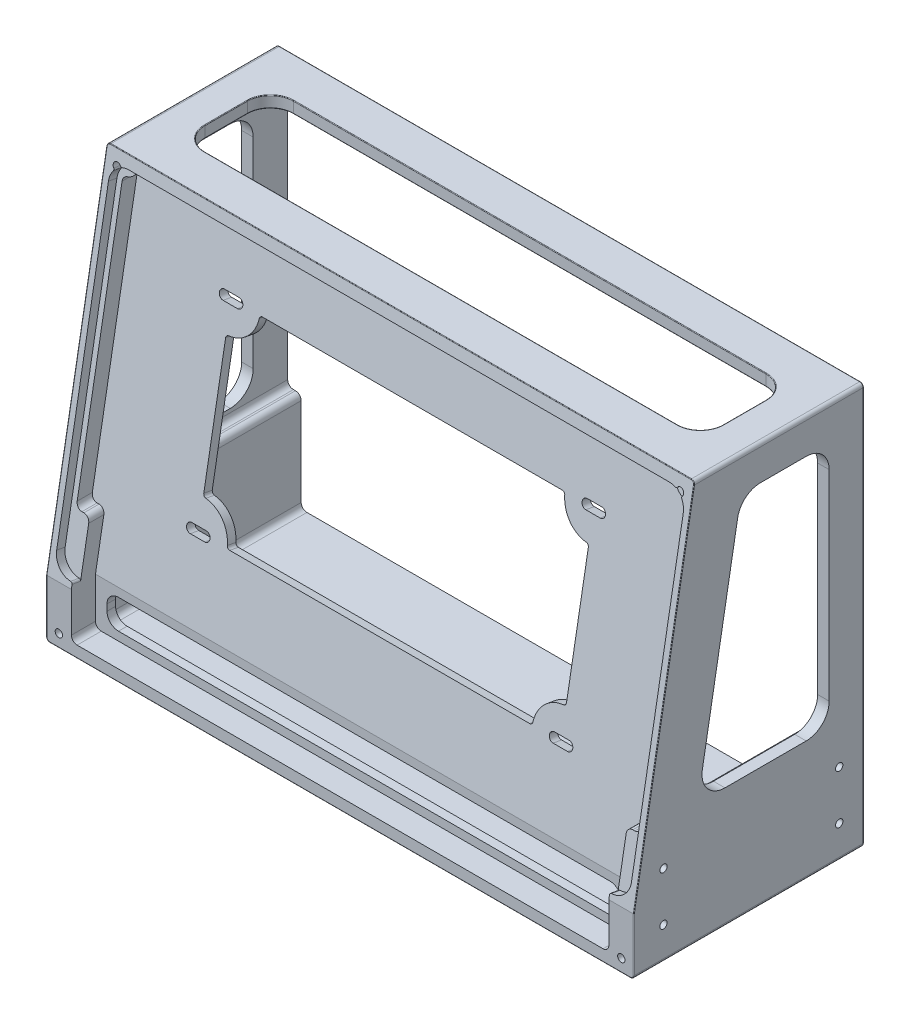
from build123d import *

# Parameters (mm, degrees)
EXTRUDE_1_DEPTH                   = 80
FILLET_1_R                        = 1.2
SKETCH_11_R                       = 4.351471862576191
EXTRUDE_6_DEPTH                   = 80
CUT_EXTRUDE_1_DEPTH               = 231.44795507879866
EXTRUDE_3_DEPTH                   = 3
HOLE_WIZARD_M31_D                 = 3.15
HOLE_WIZARD_M31_DEPTH             = 8.5
HOLE_WIZARD_M31_TIP               = 0.9463554749684074
HOLE_WIZARD_M31_ON_FACE_2_D       = 3.15
HOLE_WIZARD_M31_ON_FACE_2_DEPTH   = 8.5
HOLE_WIZARD_M31_ON_FACE_2_TIP     = 0.9463554749684074
HOLE_WIZARD_M31_ON_FACE_3_D       = 3.15
HOLE_WIZARD_M31_ON_FACE_3_DEPTH   = 8.5
HOLE_WIZARD_M31_ON_FACE_3_TIP     = 0.9463554749684074
HOLE_WIZARD_M2_51_D               = 2.55
HOLE_WIZARD_M2_51_DEPTH           = 20
HOLE_WIZARD_M2_51_TIP             = 0.7660972892601393
FILLET_2_R                        = 1
HOLE_WIZARD_M2_52_D               = 2.55
HOLE_WIZARD_M2_52_DEPTH           = 8.5
HOLE_WIZARD_M2_52_TIP             = 0.7660972892601393
HOLE_WIZARD_M2_52_ON_FACE_2_D     = 2.55
HOLE_WIZARD_M2_52_ON_FACE_2_DEPTH = 8.5
HOLE_WIZARD_M2_52_ON_FACE_2_TIP   = 0.7660972892601393
HOLE_WIZARD_M2_52_ON_FACE_3_D     = 2.55
HOLE_WIZARD_M2_52_ON_FACE_3_DEPTH = 8.5
HOLE_WIZARD_M2_52_ON_FACE_3_TIP   = 0.7660972892601393
EXTRUDE_7_REACH                   = 149.449
FILLET_3_R                        = 2
HOLE_WIZARD_M30_D                 = 2.55
HOLE_WIZARD_M30_DEPTH             = 7
HOLE_WIZARD_M30_TIP               = 0.7660972892601393
HOLE_WIZARD_M30_ON_FACE_2_D       = 2.55
HOLE_WIZARD_M30_ON_FACE_2_DEPTH   = 7
HOLE_WIZARD_M30_ON_FACE_2_TIP     = 0.7660972892601393
CUT_EXTRUDE_2_DEPTH               = 227.90583965618865
EXTRUDE_8_DEPTH                   = 3
CUT_EXTRUDE_3_DEPTH               = 4
HOLE_WIZARD_M31_2_D               = 3.4
HOLE_WIZARD_M31_2_DEPTH           = 8.5
HOLE_WIZARD_M31_2_CBORE_D         = 6.5
HOLE_WIZARD_M31_2_CBORE_DEPTH     = 3
HOLE_WIZARD_M31_2_TIP             = 1.0214630523468524
SKETCH_22_W                       = 180.5
SKETCH_22_H                       = 30.840762314985035
CUT_EXTRUDE_4_DEPTH               = 4
CUT_EXTRUDE_5_DEPTH               = 231.44795523258608
FILLET_26_R                       = 8
FILLET_27_R                       = 0.2
CUT_EXTRUDE_8_DEPTH               = 3
FILLET_32_R                       = 4
CUT_EXTRUDE_START                 = -73.991163
CUT_EXTRUDE_9_DEPTH               = 82.191163
FILLET_33_R                       = 0.6


with BuildPart() as part:
    # Эскиз2 → Вытянуть-Тонкостенный1 (new body)
    with BuildSketch(Plane.XY):
        Polygon((-102.25000000000003, 69.89999999999998), (102.24999999999997, 69.9), (102.24999999999997, -69.9), (-102.25000000000003, -69.90000000000003), align=None)
        Polygon((-98.25000000000003, 65.89999999999998), (98.24999999999997, 65.9), (98.24999999999997, -65.9), (-98.25000000000003, -65.90000000000003), align=None, mode=Mode.SUBTRACT)
    extrude(amount=EXTRUDE_1_DEPTH)

    # Скругление1
    fillet_1_edges = [part.edges().sort_by_distance(p)[0] for p in [
        (-98.25000000000003, 65.89999999999998, 40),
        (-98.25000000000003, -65.90000000000003, 40),
        (98.24999999999997, -65.9, 40),
        (98.24999999999997, 65.9, 40),
        (-102.25000000000003, 69.89999999999998, 40),
        (102.24999999999997, 69.9, 40),
        (102.24999999999997, -69.9, 40),
        (-102.25000000000003, -69.90000000000003, 40),
    ]]
    fillet(fillet_1_edges, radius=FILLET_1_R)

    # Эскиз11 → Бобышка-Вытянуть6 (add)
    with BuildSketch(Plane.XY.offset(80)):
        with Locations((-97.89852813742387, 65.54852813742384)):
            Circle(SKETCH_11_R)
        with Locations((97.89852813742382, 65.54852813742386)):
            Circle(SKETCH_11_R)
        with Locations((97.89852813742382, -65.54852813742386)):
            Circle(SKETCH_11_R)
        with Locations((-97.89852813742388, -65.54852813742389)):
            Circle(SKETCH_11_R)
    extrude(amount=-EXTRUDE_6_DEPTH)

    # Эскиз3 → Вырез-Вытянуть1 (cut, through all)
    with BuildSketch(Plane.ZY.offset(102.25000000000003)):
        Polygon((58.84076231498504, 69.9), (80, -50.099999999999994), (80, 69.9), align=None)
    extrude(amount=-CUT_EXTRUDE_1_DEPTH, mode=Mode.SUBTRACT)

    # Эскиз5 → Бобышка-Вытянуть3 (add)
    with BuildSketch(Plane(origin=(0, 10.746190826844586, 60.94467666642872), x_dir=(1, 0, 0), z_dir=(0, 0.17364817766692367, 0.9848077530122092))):
        Polygon((98.24999999999996, -61.379529212976315), (-98.25000000000003, -61.37952921297633), (-98.25000000000001, 58.62047078702366), (98.24999999999996, 58.620470787023685), align=None)
        with BuildLine():
            Line((-52.3264805488782, 30.61799992049595), (53.9500000000002, 30.61799992049597))
            ThreePointArc((53.9500000000002, 30.61799992049597), (56.878932188134726, 23.546932108630493), (63.9500000000002, 20.61799992049596))
            Line((63.9500000000002, 20.61799992049596), (63.9500000000002, -25.032000079503785))
            ThreePointArc((63.9500000000002, -25.032000079503785), (56.878932188134726, -27.96093226763831), (53.9500000000002, -35.03200007950379))
            Line((53.9500000000002, -35.03200007950379), (-52.32648054887819, -35.03200007950379))
            ThreePointArc((-52.32648054887819, -35.03200007950379), (-55.25541273701272, -27.96093226763832), (-62.326480548878195, -25.0320000795038))
            Line((-62.326480548878195, -25.0320000795038), (-62.3264805488782, 20.617999920495947))
            ThreePointArc((-62.3264805488782, 20.617999920495947), (-55.255412737012726, 23.54693210863047), (-52.3264805488782, 30.61799992049595))
        make_face(mode=Mode.SUBTRACT)
    extrude(amount=-EXTRUDE_3_DEPTH)

    # Hole Wizard M31
    with Locations(Plane(origin=(63.95, 40.378089997, 52.673493517), x_dir=(0, -0.984807753012, 0.173648177667), z_dir=(0, -0.173648177667, -0.984807753012))):
        with Locations((0, 0)):
            Hole(HOLE_WIZARD_M31_D / 2, depth=HOLE_WIZARD_M31_DEPTH)
            with Locations((0, 0, -(HOLE_WIZARD_M31_DEPTH + HOLE_WIZARD_M31_TIP / 2))):  # 118° drill point
                Cone(0, HOLE_WIZARD_M31_D / 2, HOLE_WIZARD_M31_TIP, mode=Mode.SUBTRACT)

    # Hole Wizard M31 on face 2
    with Locations(Plane(origin=(-62.326480549, 40.378089997, 52.673493517), x_dir=(0, -0.984807790843, 0.17364796312), z_dir=(0, -0.17364796312, -0.984807790843))):
        with Locations((0, 0)):
            Hole(HOLE_WIZARD_M31_ON_FACE_2_D / 2, depth=HOLE_WIZARD_M31_ON_FACE_2_DEPTH)
            with Locations((0, 0, -(HOLE_WIZARD_M31_ON_FACE_2_DEPTH + HOLE_WIZARD_M31_ON_FACE_2_TIP / 2))):  # 118° drill point
                Cone(0, HOLE_WIZARD_M31_ON_FACE_2_D / 2, HOLE_WIZARD_M31_ON_FACE_2_TIP, mode=Mode.SUBTRACT)

    # Hole Wizard M31 on face 3
    with Locations(Plane(origin=(-62.326480549, -24.274538988, 64.073496381), x_dir=(0, -0.984807790843, 0.17364796312), z_dir=(0, -0.17364796312, -0.984807790843))):
        with Locations((0, 0), (0, -126.276480549)):
            Hole(HOLE_WIZARD_M31_ON_FACE_3_D / 2, depth=HOLE_WIZARD_M31_ON_FACE_3_DEPTH)
            with Locations((0, 0, -(HOLE_WIZARD_M31_ON_FACE_3_DEPTH + HOLE_WIZARD_M31_ON_FACE_3_TIP / 2))):  # 118° drill point
                Cone(0, HOLE_WIZARD_M31_ON_FACE_3_D / 2, HOLE_WIZARD_M31_ON_FACE_3_TIP, mode=Mode.SUBTRACT)

    # Сверло под метчик  спиральное M2.51
    with Locations(Plane(origin=(97.898528137, 65.548528137, 0), x_dir=(-1, 0, 0), z_dir=(0, 0, -1))):
        with Locations((0, 0), (195.797056274, -131.097056274), (0, -131.097056274), (195.797056274, 0)):
            Hole(HOLE_WIZARD_M2_51_D / 2, depth=HOLE_WIZARD_M2_51_DEPTH)
            with Locations((0, 0, -(HOLE_WIZARD_M2_51_DEPTH + HOLE_WIZARD_M2_51_TIP / 2))):  # 118° drill point
                Cone(0, HOLE_WIZARD_M2_51_D / 2, HOLE_WIZARD_M2_51_TIP, mode=Mode.SUBTRACT)

    # Скругление2
    fillet_2_edges = [part.edges().sort_by_distance(p)[0] for p in [
        (-52.3264805488782, 40.63856226377582, 54.15070514691027),
        (53.9500000000002, 40.63856226377584, 54.15070514691026),
        (63.9500000000002, 30.790484733653738, 55.887186923579506),
        (63.9500000000002, -14.165989191353361, 63.81422623407453),
        (53.9500000000002, -24.014066721475462, 65.55070801074378),
        (-52.32648054887819, -24.014066721475462, 65.55070801074378),
        (-62.326480548878195, -14.165989191353376, 63.81422623407453),
        (-62.3264805488782, 30.790484733653724, 55.887186923579506),
    ]]
    fillet(fillet_2_edges, radius=FILLET_2_R)

    # Сверло под метчик  спиральное M2.52
    with Locations(Plane(origin=(-98.021320344, 65.021320344, 59.701005169), x_dir=(0, 0.984807753012, -0.173648177667), z_dir=(0, 0.173648177667, 0.984807753012))):
        with Locations((0, 0)):
            Hole(HOLE_WIZARD_M2_52_D / 2, depth=HOLE_WIZARD_M2_52_DEPTH)
            with Locations((0, 0, -(HOLE_WIZARD_M2_52_DEPTH + HOLE_WIZARD_M2_52_TIP / 2))):  # 118° drill point
                Cone(0, HOLE_WIZARD_M2_52_D / 2, HOLE_WIZARD_M2_52_TIP, mode=Mode.SUBTRACT)

    # Сверло под метчик  спиральное M2.52 on face 2
    with Locations(Plane(origin=(98.021320344, 65.021320344, 59.701005169), x_dir=(0, 0.984807790843, -0.17364796312), z_dir=(0, 0.17364796312, 0.984807790843))):
        with Locations((0, 0)):
            Hole(HOLE_WIZARD_M2_52_ON_FACE_2_D / 2, depth=HOLE_WIZARD_M2_52_ON_FACE_2_DEPTH)
            with Locations((0, 0, -(HOLE_WIZARD_M2_52_ON_FACE_2_DEPTH + HOLE_WIZARD_M2_52_ON_FACE_2_TIP / 2))):  # 118° drill point
                Cone(0, HOLE_WIZARD_M2_52_ON_FACE_2_D / 2, HOLE_WIZARD_M2_52_ON_FACE_2_TIP, mode=Mode.SUBTRACT)

    # Сверло под метчик  спиральное M2.52 on face 3
    with Locations(Plane(origin=(-97.898528137, -65.548528137, 80), x_dir=(1, 0, 0), z_dir=(0, 0, 1))):
        with Locations((0, 0), (195.797056274, 0)):
            Hole(HOLE_WIZARD_M2_52_ON_FACE_3_D / 2, depth=HOLE_WIZARD_M2_52_ON_FACE_3_DEPTH)
            with Locations((0, 0, -(HOLE_WIZARD_M2_52_ON_FACE_3_DEPTH + HOLE_WIZARD_M2_52_ON_FACE_3_TIP / 2))):  # 118° drill point
                Cone(0, HOLE_WIZARD_M2_52_ON_FACE_3_D / 2, HOLE_WIZARD_M2_52_ON_FACE_3_TIP, mode=Mode.SUBTRACT)

    # Бобышка-Вытянуть7: up to this face of the body (flat: up to its plane)
    extrude_7_end = Plane(part.part.faces().sort_by_distance((0, -66.482717226, 80))[0])
    # Эскиз17 → Бобышка-Вытянуть7 (add, up to the picked face)
    with BuildSketch(Plane(origin=(0, 0, 0), x_dir=(-1, 0, 0), z_dir=(0, 0, -1)), mode=Mode.PRIVATE) as extrude_7_sk1:
        with BuildLine():
            Line((-98.24999999999996, -31.211273833073058), (-93.54705627484763, -31.211273833073058))
            Line((-93.54705627484763, -31.211273833073058), (-93.54705627484763, -65.54852813742386))
            ThreePointArc((-93.54705627484763, -65.54852813742386), (-94.9484529307295, -62.34972154032553), (-98.24999999999996, -61.21127383307306))
            Line((-98.24999999999996, -61.21127383307306), (-98.24999999999996, -31.211273833073058))
        make_face()
    extrude_7_tool1 = split(extrude(extrude_7_sk1.sketch, amount=-EXTRUDE_7_REACH, mode=Mode.PRIVATE), bisect_by=extrude_7_end, keep=Keep.BOTH, mode=Mode.PRIVATE)
    # Эскиз17 → Бобышка-Вытянуть7 (add, up to the picked face)
    with BuildSketch(Plane(origin=(0, 0, 0), x_dir=(-1, 0, 0), z_dir=(0, 0, -1)), mode=Mode.PRIVATE) as extrude_7_sk2:
        with BuildLine():
            Line((98.25000000000001, -61.211273833073086), (98.25000000000001, -31.211273833073058))
            Line((98.25000000000001, -31.211273833073058), (93.54705627484768, -31.211273833073058))
            Line((93.54705627484768, -31.211273833073058), (93.54705627484768, -65.54852813742389))
            ThreePointArc((93.54705627484768, -65.54852813742389), (94.94845293072957, -62.34972154032556), (98.25000000000001, -61.211273833073086))
        make_face()
    extrude_7_tool2 = split(extrude(extrude_7_sk2.sketch, amount=-EXTRUDE_7_REACH, mode=Mode.PRIVATE), bisect_by=extrude_7_end, keep=Keep.BOTH, mode=Mode.PRIVATE)
    add(extrude_7_tool1.solids().sort_by(Axis((95.859918, -46.651477, 0), (0, 0, 1)))[0])
    add(extrude_7_tool2.solids().sort_by(Axis((-95.859918, -46.651477, 0), (0, 0, 1)))[0])

    # Скругление3
    fillet_3_edges = [part.edges().sort_by_distance(p)[0] for p in [
        (93.54705627484763, -31.211273833073058, 32.6483149462183),
        (98.24999999999996, -31.211273833073058, 32.64831494621829),
        (-98.25000000000001, -31.211273833073058, 32.64831494621829),
        (-93.54705627484768, -31.211273833073058, 32.6483149462183),
        (-93.56127383307307, -65.90000000000003, 40),
        (93.56127383307302, -65.9, 40),
        (-93.56127383307306, 65.89999999999998, 24.08664609234927),
        (-98.25000000000003, 61.211273833073044, 24.500020556540754),
        (93.56127383307302, 65.9, 24.08664609234927),
        (98.24999999999997, 61.21127383307306, 24.500020556540747),
        (-93.54705627484768, -31.211273833073058, 74.17145486404691),
        (-98.25000000000001, -31.211273833073058, 72.50615883682536),
        (93.54705627484763, -31.211273833073058, 74.17145486404691),
        (98.24999999999996, -31.211273833073058, 72.50615883682536),
        (98.24999999999997, 61.21127383307306, 56.20957005747029),
        (93.56127383307302, 65.9, 55.382821129087326),
        (-93.56127383307306, 65.89999999999998, 55.38282112908733),
        (-98.25000000000003, 61.211273833073044, 56.20957005747029),
    ]]
    fillet(fillet_3_edges, radius=FILLET_3_R)

    # Сверло под метчик  спиральное M30
    with Locations(Plane(origin=(-102.25, -58.5, 8.494092032), x_dir=(0, 0, -1), z_dir=(-1, 0, 0))):
        with Locations((0, 0), (0, -17), (-61.16, -17), (-61.194717253, -0.01995702)):
            Hole(HOLE_WIZARD_M30_D / 2, depth=HOLE_WIZARD_M30_DEPTH)
            with Locations((0, 0, -(HOLE_WIZARD_M30_DEPTH + HOLE_WIZARD_M30_TIP / 2))):  # 118° drill point
                Cone(0, HOLE_WIZARD_M30_D / 2, HOLE_WIZARD_M30_TIP, mode=Mode.SUBTRACT)

    # Сверло под метчик  спиральное M30 on face 2
    with Locations(Plane(origin=(102.25, -41.5, 69.654092032), x_dir=(0, 0, 1), z_dir=(1, 0, 0))):
        with Locations((0, 0), (0.034717253, 16.98004298), (-61.16, 0), (-61.16, 17)):
            Hole(HOLE_WIZARD_M30_ON_FACE_2_D / 2, depth=HOLE_WIZARD_M30_ON_FACE_2_DEPTH)
            with Locations((0, 0, -(HOLE_WIZARD_M30_ON_FACE_2_DEPTH + HOLE_WIZARD_M30_ON_FACE_2_TIP / 2))):  # 118° drill point
                Cone(0, HOLE_WIZARD_M30_ON_FACE_2_D / 2, HOLE_WIZARD_M30_ON_FACE_2_TIP, mode=Mode.SUBTRACT)

    # Эскиз18 → Вырез-Вытянуть2 (cut, through all)
    with BuildSketch(Plane.ZY.offset(98.25000000000001)):
        Polygon((80, -31.211273833073047), (76.66940794555691, -31.211273833073047), (80, -50.099999999999994), align=None)
    extrude(amount=-CUT_EXTRUDE_2_DEPTH, mode=Mode.SUBTRACT)

    # Эскиз19 → Бобышка-Вытянуть8 (add)
    with BuildSketch(Plane.XY.offset(71.60312006031576)):
        Polygon((-93.54705627484768, -49.70084541833389), (93.54705627484763, -49.70084541833387), (93.54705627484763, -65.90000000000003), (-93.54705627484768, -65.90000000000003), align=None)
    extrude(amount=-EXTRUDE_8_DEPTH)

    # Эскиз20 → Вырез-Вытянуть3 (cut)
    with BuildSketch(Plane.XY.offset(71.60312006031576)):
        Polygon((89.54705627484752, -62.90000000000003), (-89.54705627484768, -62.900000000000055), (-89.54705627484768, -52.700845418333934), (89.54705627484752, -52.70084541833389), align=None)
    extrude(amount=-CUT_EXTRUDE_3_DEPTH, mode=Mode.SUBTRACT)

    # Hole Wizard M31 2
    with Locations(Plane(origin=(34.797056275, -69.9, 34.30156003), x_dir=(-1, 0, 0), z_dir=(0, -1, 0))):
        with Locations((0, 0), (-39.1, 0)):
            CounterBoreHole(HOLE_WIZARD_M31_2_D / 2, HOLE_WIZARD_M31_2_CBORE_D / 2, HOLE_WIZARD_M31_2_CBORE_DEPTH, depth=HOLE_WIZARD_M31_2_DEPTH)
            with Locations((0, 0, -(HOLE_WIZARD_M31_2_DEPTH + HOLE_WIZARD_M31_2_TIP / 2))):  # 118° drill point
                Cone(0, HOLE_WIZARD_M31_2_D / 2, HOLE_WIZARD_M31_2_TIP, mode=Mode.SUBTRACT)

    # Эскиз22 → Вырез-Вытянуть4 (cut)
    with BuildSketch(Plane(origin=(-9.49e-15, 69.89999999999999, 0), x_dir=(1, 1.3e-16, 0), z_dir=(-1.3e-16, 1, 0))):
        with Locations((-1.421e-14, -29.420381157492518)):
            Rectangle(SKETCH_22_W, SKETCH_22_H)
    extrude(amount=-CUT_EXTRUDE_4_DEPTH, mode=Mode.SUBTRACT)

    # Эскиз23 → Вырез-Вытянуть5 (cut, through all)
    with BuildSketch(Plane(origin=(102.24999999999997, 0, 0), x_dir=(0, 0, -1), z_dir=(1, 0, 0))):
        Polygon((-42.679007069543154, 57.90000000000002), (-12, 57.900000000000034), (-11.99999999999999, -27.899999999999974), (-57.80786201432885, -27.899999999999995), align=None)
    extrude(amount=-CUT_EXTRUDE_5_DEPTH, mode=Mode.SUBTRACT)

    # Скругление26
    fillet_26_edges = [part.edges().sort_by_distance(p)[0] for p in [
        (90.24999999999997, 67.9, 44.840762314985035),
        (90.24999999999997, 67.9, 14),
        (-90.25000000000003, 67.89999999999998, 14),
        (-90.25000000000003, 67.89999999999998, 44.840762314985035),
        (-100.25000000000003, -27.899999999999995, 57.80786201432885),
        (-100.25000000000003, 57.90000000000002, 42.679007069543154),
        (-100.25000000000003, 57.900000000000034, 12),
        (-100.25000000000003, -27.899999999999974, 11.99999999999999),
        (100.24999999999997, -27.899999999999995, 57.80786201432885),
        (100.24999999999997, 57.90000000000002, 42.679007069543154),
        (100.24999999999997, 57.900000000000034, 12),
        (100.24999999999997, -27.899999999999974, 11.99999999999999),
    ]]
    fillet(fillet_26_edges, radius=FILLET_26_R)

    # Скругление27
    fillet_27_edges = [part.edges().sort_by_distance(p)[0] for p in [
        (-102.25000000000003, -59.40000000000002, 80),
        (-1.421e-14, 69.9, 58.84076231498504),
        (-102.25000000000003, 9.299999999999983, 69.5261773459176),
        (101.90176912437792, 69.54527472383623, 58.90330995191197),
        (-101.90176912437798, 69.5452747238362, 58.90330995191197),
        (102.24999999999997, 9.300000000000004, 69.5261773459176),
        (-2.842e-14, -69.90000000000002, 0),
        (-2.842e-14, -69.90000000000002, 80),
        (-102.25000000000003, -2.842e-14, 0),
        (-2.842e-14, 69.89999999999999, 0),
        (102.24999999999997, 0, 0),
        (-101.89852813742388, 69.54852813742383, 0),
        (101.89852813742382, 69.54852813742386, 0),
        (101.89852813742382, -69.54852813742386, 0),
        (-101.89852813742388, -69.54852813742389, 0),
        (102.24999999999997, -59.4, 80),
        (101.89852813742382, -69.54852813742386, 80),
        (-101.89852813742388, -69.54852813742389, 80),
        (-2.37e-14, 69.89999999999999, 14),
        (-2.316e-14, 65.89999999999999, 14),
        (90.24999999999997, 69.9, 29.420381157492518),
        (90.24999999999997, 65.9, 29.420381157492518),
        (-2.37e-14, 69.89999999999999, 44.840762314985035),
        (-2.316e-14, 65.89999999999999, 44.840762314985035),
        (-90.25000000000003, 69.89999999999998, 29.420381157492518),
        (-90.25000000000003, 65.89999999999998, 29.420381157492518),
        (87.90685424949235, 69.9, 16.34314575050762),
        (87.90685424949235, 65.9, 16.34314575050762),
        (87.90685424949235, 69.9, 42.49761656447742),
        (87.90685424949235, 65.9, 42.49761656447742),
        (-87.90685424949241, 69.89999999999998, 42.49761656447741),
        (-87.90685424949241, 65.89999999999998, 42.49761656447741),
        (-87.90685424949241, 69.89999999999998, 16.34314575050762),
        (-87.90685424949241, 65.89999999999998, 16.34314575050762),
    ]]
    fillet(fillet_27_edges, radius=FILLET_27_R)

    # Эскиз27 → Вырез-Вытянуть8 (cut)
    with BuildSketch(Plane(origin=(0, 12.170105883713362, 69.02010024112883), x_dir=(1, 0, 0), z_dir=(0, 0.17364817766692367, 0.9848077530122092))):
        with BuildLine():
            Line((-94.05000000000001, 54.55876433948067), (94.04999999999995, 54.558764339480675))
            ThreePointArc((94.04999999999995, 54.558764339480675), (98.29264068711925, 52.80140502659995), (100.04999999999995, 48.55876433948067))
            Line((100.04999999999995, 48.55876433948067), (100.04999999999998, -55.23072263926557))
            ThreePointArc((100.04999999999998, -55.23072263926557), (98.29264068711923, -59.473363326384856), (94.04999999999994, -61.23072263926557))
            Line((94.04999999999994, -61.23072263926557), (-94.05, -61.23072263926557))
            ThreePointArc((-94.05, -61.23072263926557), (-98.29264068711929, -59.473363326384856), (-100.04999999999998, -55.23072263926557))
            Line((-100.04999999999998, -55.23072263926557), (-100.05000000000001, 48.55876433948067))
            ThreePointArc((-100.05000000000001, 48.55876433948067), (-98.2926406871193, 52.80140502659995), (-94.05000000000001, 54.55876433948067))
        make_face()
    extrude(amount=-CUT_EXTRUDE_8_DEPTH, mode=Mode.SUBTRACT)

    # Скругление32
    fillet_32_edges = [part.edges().sort_by_distance(p)[0] for p in [
        (-89.54705627484768, -62.900000000000055, 70.10312006031576),
        (-89.54705627484768, -52.700845418333934, 70.10312006031576),
        (89.54705627484752, -52.70084541833389, 70.10312006031576),
        (89.54705627484752, -62.90000000000003, 70.10312006031576),
    ]]
    fillet(fillet_32_edges, radius=FILLET_32_R)

    # Эскиз28 → Вырез-Вытянуть9 (cut)
    with BuildSketch(Plane(origin=(-1.52e-15, 10.746190826844591, 60.94467666642872), x_dir=(1, 0, 2e-17), z_dir=(0, 0.17364817766692373, 0.9848077530122092)).offset(CUT_EXTRUDE_START)):
        with BuildLine():
            Line((-59.82648054887821, 29.042999920495966), (-64.8264805488782, 29.042999920495966))
            ThreePointArc((-64.8264805488782, 29.042999920495966), (-66.40148054887818, 30.617999920495958), (-64.8264805488782, 32.19299992049595))
            Line((-64.8264805488782, 32.19299992049595), (-59.82648054887821, 32.19299992049595))
            ThreePointArc((-59.82648054887821, 32.19299992049595), (-58.25148054887822, 30.617999920495958), (-59.82648054887821, 29.042999920495966))
        make_face()
        with BuildLine():
            Line((66.45000000000017, 29.042999920495976), (61.45000000000017, 29.042999920495976))
            ThreePointArc((61.45000000000017, 29.042999920495976), (59.87500000000018, 30.617999920495976), (61.45000000000017, 32.19299992049597))
            Line((61.45000000000017, 32.19299992049597), (66.45000000000017, 32.19299992049597))
            ThreePointArc((66.45000000000017, 32.19299992049597), (68.02500000000018, 30.617999920495976), (66.45000000000017, 29.042999920495976))
        make_face()
        with BuildLine():
            Line((66.4500000000002, -36.60700007950377), (61.4500000000002, -36.60700007950377))
            ThreePointArc((61.4500000000002, -36.60700007950377), (59.875000000000206, -35.03200007950378), (61.4500000000002, -33.457000079503786))
            Line((61.4500000000002, -33.457000079503786), (66.4500000000002, -33.457000079503786))
            ThreePointArc((66.4500000000002, -33.457000079503786), (68.02500000000019, -35.03200007950378), (66.4500000000002, -36.60700007950377))
        make_face()
        with BuildLine():
            Line((-59.82648054887818, -36.60700007950379), (-64.82648054887818, -36.60700007950379))
            ThreePointArc((-64.82648054887818, -36.60700007950379), (-66.40148054887818, -35.032000079503796), (-64.82648054887818, -33.45700007950379))
            Line((-64.82648054887818, -33.45700007950379), (-59.82648054887818, -33.45700007950379))
            ThreePointArc((-59.82648054887818, -33.45700007950379), (-58.251480548878185, -35.032000079503796), (-59.82648054887818, -36.60700007950379))
        make_face()
    extrude(amount=CUT_EXTRUDE_9_DEPTH, mode=Mode.SUBTRACT)

    # Скругление33
    # the kernel refuses this fillet: 0.6 mm, written as the material it takes off along each edge
    with BuildSketch(Plane(origin=(93.54705627484763, -48.65132902697635, 76.69828038562953), x_dir=(0.9999993977966124, 0.0010807817150727218, -0.00019057097662368192), z_dir=(0, 0.17364817766692367, 0.9848077530122094))) as fillet_33_piece_1:
        with BuildLine():
            CenterArc((0.5993419491880855, -0.599944442891767), FILLET_33_R, 90.77971371328516, 89.157406762167)
            Line((-0.00065768948987629, -0.5992859701826759), (-0.0606576533576753, -0.5992201229117684))
            Line((-0.0606576533576753, -0.5992201229117684), (-0.05999996386779902, 6.584727090993e-05))
            Line((-0.05999996386779902, 6.584727090993e-05), (6.584727090747e-05, 0.05999996386780315))
            ThreePointArc((6.584727090747e-05, 0.05999996386780315), (0.5030092695487988, 0.05944800600577636), (0.5903605692061336, 0.05999444428917419))
            Line((0.5903605692061336, 0.05999444428917419), (0.5911770582954019, 0))
        make_face()
    extrude(amount=4.49821582768737, mode=Mode.SUBTRACT)
    with BuildSketch(Plane(origin=(-93.54705627484768, -48.65132902697635, 76.69828038562953), x_dir=(0, -0.9848077530122091, 0.17364817766692364), z_dir=(0, 0.17364817766692367, 0.9848077530122094))) as fillet_33_piece_2:
        with BuildLine():
            CenterArc((0.5992863310749345, -0.5999999999999943), FILLET_33_R, 90, 89.15740676216856)
            Line((-0.00064878993187822, -0.5911767022865604), (-0.06064230203256422, -0.590294372515217))
            ThreePointArc((-0.06064230203256422, -0.590294372515217), (-0.06000000000000145, -0.5029437251523206), (-0.06000000000000393, 0))
            Line((-0.06000000000000393, 0), (-2.47e-15, 0.06000000000000227))
            Line((-2.47e-15, 0.06000000000000227), (0.5992863310749345, 0.06000000000000227))
            Line((0.5992863310749345, 0.06000000000000227), (0.5992863310749345, 0))
        make_face()
    extrude(amount=4.4982158276874, mode=Mode.SUBTRACT)
    with BuildSketch(Plane(origin=(98.56317738314158, 64.13653428960792, 61.32950543262144), x_dir=(0.8039018895959714, 0.5857261557062778, -0.10327934171736429), z_dir=(-1.3522911182652382e-07, -0.17364802564458143, -0.9848077798178284))) as fillet_33_piece_3_section:
        with BuildLine():
            CenterArc((0.619704217382117, 0.5882744414211366), FILLET_33_R, 180.8178456751015, 77.83626368146133)
            ThreePointArc((0.01976534132183894, 0.5797102723706204), (0.01689216907732628, 0.28961614589085594), (0, 0))
            ThreePointArc((0, 0), (0.2508326594165713, 0.02491681198009434), (0.5016653188331496, 1e-17))
        make_face()
    fillet_33_piece_3 = extrude(amount=5.900236394317467, mode=Mode.PRIVATE)
    fillet_33_piece_3 = split(fillet_33_piece_3, bisect_by=Plane(origin=(98.75083217533158, 63.317247499648204, 56.9551993524659), z_dir=(0, 0.17364817766692367, 0.9848077530122092)), keep=Keep.TOP, mode=Mode.PRIVATE)
    add(fillet_33_piece_3, mode=Mode.SUBTRACT)
    with BuildSketch(Plane(origin=(96.76924026920764, 64.73738693944462, 56.70479045286158), x_dir=(-0.9122702422838338, 0.4033662572027118, -0.07112431084847852), z_dir=(3.814713190959619e-08, 0.17364815856687052, 0.984807756380063))) as fillet_33_piece_4:
        with BuildLine():
            CenterArc((0.6090498056644318, -0.5992986421108195), FILLET_33_R, 92.77060212093097, 77.83628713520405)
            ThreePointArc((0.01709472997128211, -0.5013742408560072), (0.03344973312373674, -0.24983805554936112), (0, 0))
            ThreePointArc((0, 0), (0.29002371698306406, -0.00701357889180697), (0.5800474339661211, -2e-17))
        make_face()
    extrude(amount=4.450118351781803, mode=Mode.SUBTRACT)
    with BuildSketch(Plane(origin=(-96.76924038364905, 65.51014177474578, 61.087301236395525), x_dir=(0.9122702264297412, 0.40336628455531615, -0.07112435907527398), z_dir=(0, -0.1736481776670335, -0.9848077530121899))) as fillet_33_piece_5:
        with BuildLine():
            CenterArc((0.6090495878113149, -0.5992986426128553), FILLET_33_R, 92.77060112913193, 77.83627132411394)
            ThreePointArc((0.0170945408360579, -0.5013740677579032), (0.03344962087370987, -0.24983797870408642), (0, 0))
            ThreePointArc((0, 0), (0.29002361324346587, -0.00701357387144328), (0.5800472264869588, -1e-17))
        make_face()
    extrude(amount=4.450118066217194, mode=Mode.SUBTRACT)
    with BuildSketch(Plane(origin=(-98.56317718704335, 64.13653448685355, 61.329505262148764), x_dir=(-0.803901970018043, 0.5857260515907504, -0.10327930619935084), z_dir=(0, -0.1736481776670335, -0.9848077530121899))) as fillet_33_piece_6:
        with BuildLine():
            CenterArc((0.6197043245285919, -0.5882744373260379), FILLET_33_R, 101.34589263118488, 77.83627132411553)
            ThreePointArc((0.01976544702883212, -0.5797103691145807), (0.01689222431395262, -0.289616192943312), (0, 0))
            ThreePointArc((0, 0), (0.2508327027853813, -0.02491682068216356), (0.5016654055707723, -4e-17))
        make_face()
    extrude(amount=4.450118066217258, mode=Mode.SUBTRACT)


solid = part.part
